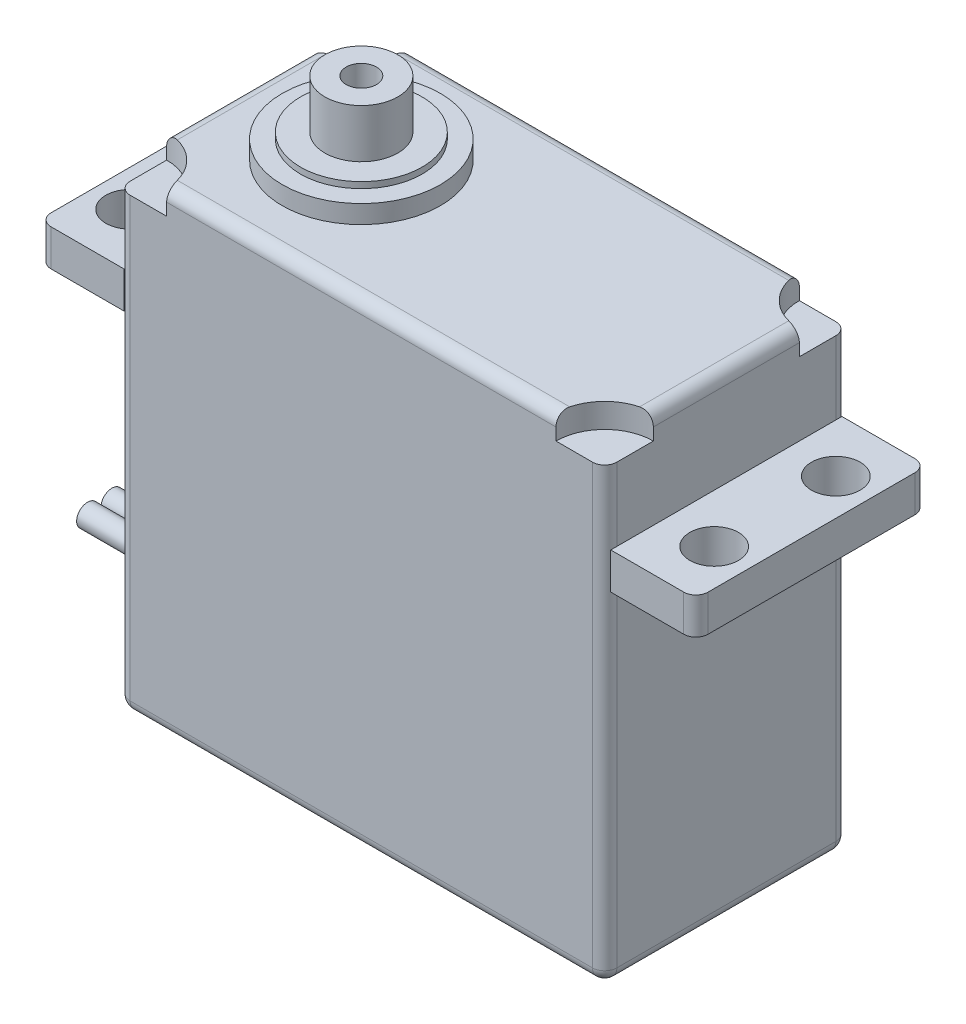
from build123d import *

# Parameters (mm, degrees)
SKETCH_2_W                = 40
SKETCH_2_H                = 39
EXTRUDE_1_DEPTH           = 10
FILLET_1_R                = 1
SKETCH_6_R                = 4
CUT_EXTRUDE_1_DEPTH       = 2
HOLE_WIZARD_2_0_2_2_D     = 2
HOLE_WIZARD_2_0_2_2_DEPTH = 10
HOLE_WIZARD_2_0_2_2_TIP   = 0.600860619
EXTRUDE_START             = -8
SKETCH_16_W               = 7
SKETCH_16_H               = 19
SKETCH_16_R               = 2
EXTRUDE_2_DEPTH           = 3
SKETCH_17_R               = 6.5
EXTRUDE_3_DEPTH           = 1.5
SKETCH_18_R               = 5
EXTRUDE_4_DEPTH           = 0.5
SKETCH_19_R               = 3
EXTRUDE_5_DEPTH           = 4
FILLET_2_R                = 1
HOLE_WIZARD_M3_1_D        = 2.5
HOLE_WIZARD_M3_1_DEPTH    = 5.55
HOLE_WIZARD_M3_1_TIP      = 0.751075774
SKETCH_22_W               = 7.5
SKETCH_22_H               = 5
EXTRUDE_6_DEPTH           = 1
LOFT_1_OUTLINE_W          = 3.5
LOFT_1_OUTLINE_H          = 6
LOFT_1_DEPTH              = 4.5
LOFT_1_DRAFT              = -3.1798301
SKETCH_26_R               = 0.9
EXTRUDE_8_DEPTH           = 5


# Read off the part's stored shape, not the designer's step: 放样1
with BuildPart() as part:
    # 草图2 → 凸台-拉伸1 (new, symmetric)
    with BuildSketch(Plane.XY):
        with Locations((20, -19.5)):
            Rectangle(SKETCH_2_W, SKETCH_2_H)
    extrude(amount=EXTRUDE_1_DEPTH, both=True)

    # 圆角1
    fillet_1_edges = [part.edges().sort_by_distance(p)[0] for p in [
        (40, -19.5, 10),
        (20, 0, 10),
        (0, -19.5, 10),
        (20, 0, -10),
        (40, -19.5, -10),
        (20, -39, -10),
        (0, -19.5, -10),
        (20, -39, 10),
        (0, 0, 0),
        (40, 0, 0),
        (40, -39, 0),
        (0, -39, 0),
    ]]
    fillet(fillet_1_edges, radius=FILLET_1_R)

    # 草图6 → 切除-拉伸1 (cut)
    with BuildSketch(Plane.XZ):
        with Locations((0, 10)):
            Circle(SKETCH_6_R)
        with Locations((40, 10)):
            Circle(SKETCH_6_R)
        with Locations((40, -10)):
            Circle(SKETCH_6_R)
        with Locations((0, -10)):
            Circle(SKETCH_6_R)
    extrude(amount=CUT_EXTRUDE_1_DEPTH, mode=Mode.SUBTRACT)

    # Ø2.0 (2) 直径孔2
    with Locations(Plane(origin=(0, -39, 0), x_dir=(-1, 0, 0), z_dir=(0, -1, 0))):
        with Locations((-37.5, 7.5), (-37.5, -7.5), (-2.5, 7.5), (-2.5, -7.5)):
            Hole(HOLE_WIZARD_2_0_2_2_D / 2, depth=HOLE_WIZARD_2_0_2_2_DEPTH)
            with Locations((0, 0, -(HOLE_WIZARD_2_0_2_2_DEPTH + HOLE_WIZARD_2_0_2_2_TIP / 2))):  # 118° drill point
                Cone(0, HOLE_WIZARD_2_0_2_2_D / 2, HOLE_WIZARD_2_0_2_2_TIP, mode=Mode.SUBTRACT)

    # 草图16 → 凸台-拉伸2 (add)
    # profile 1 of 2: a face of its own
    with BuildSketch(Plane(origin=(0, 0, 0), x_dir=(1, 0, 0), z_dir=(0, 1, 0)).offset(EXTRUDE_START)):
        with Locations((-3.5, 0)):
            Rectangle(SKETCH_16_W, SKETCH_16_H)
        with Locations(Location((-4, -5, 0), (0, 0, 270))):
            Circle(SKETCH_16_R, mode=Mode.SUBTRACT)
        with Locations(Location((-4, 5, 0), (0, 0, 270))):
            Circle(SKETCH_16_R, mode=Mode.SUBTRACT)
    # profile 2 of 2: a face of its own
    with BuildSketch(Plane(origin=(0, 0, 0), x_dir=(1, 0, 0), z_dir=(0, 1, 0)).offset(EXTRUDE_START)):
        with Locations((43.5, 0)):
            Rectangle(SKETCH_16_W, SKETCH_16_H)
        with Locations(Location((44, 5, 0), (0, 0, 90))):
            Circle(SKETCH_16_R, mode=Mode.SUBTRACT)
        with Locations(Location((44, -5, 0), (0, 0, 90))):
            Circle(SKETCH_16_R, mode=Mode.SUBTRACT)
    extrude(amount=-EXTRUDE_2_DEPTH)

    # 草图17 → 凸台-拉伸3 (add)
    with BuildSketch(Plane(origin=(0, 0, 0), x_dir=(1, 0, 0), z_dir=(0, 1, 0))):
        with Locations(Location((10, 0, 0), (0, 0, 90))):
            Circle(SKETCH_17_R)
    extrude(amount=EXTRUDE_3_DEPTH)

    # 草图18 → 凸台-拉伸4 (add)
    with BuildSketch(Plane(origin=(0, 1.5, 0), x_dir=(1, 0, 0), z_dir=(0, 1, 0))):
        with Locations(Location((10, 0, 0), (0, 0, 270))):
            Circle(SKETCH_18_R)
    extrude(amount=EXTRUDE_4_DEPTH)

    # 草图19 → 凸台-拉伸5 (add)
    with BuildSketch(Plane(origin=(0, 2, 0), x_dir=(1, 0, 0), z_dir=(0, 1, 0))):
        with Locations(Location((10, 0, 0), (0, 0, 270))):
            Circle(SKETCH_19_R)
    extrude(amount=EXTRUDE_5_DEPTH)

    # 圆角2
    fillet_2_edges = [part.edges().sort_by_distance(p)[0] for p in [
        (-7, -9.5, 9.5),
        (-7, -9.5, -9.5),
        (47, -9.5, 9.5),
        (47, -9.5, -9.5),
    ]]
    fillet(fillet_2_edges, radius=FILLET_2_R)

    # M3 螺纹孔1
    with Locations(Plane(origin=(0, 6, 0), x_dir=(1, 0, 0), z_dir=(0, 1, 0))):
        with Locations((10, 0)):
            Hole(HOLE_WIZARD_M3_1_D / 2, depth=HOLE_WIZARD_M3_1_DEPTH)
            with Locations((0, 0, -(HOLE_WIZARD_M3_1_DEPTH + HOLE_WIZARD_M3_1_TIP / 2))):  # 118° drill point
                Cone(0, HOLE_WIZARD_M3_1_D / 2, HOLE_WIZARD_M3_1_TIP, mode=Mode.SUBTRACT)

    # 草图22 → 凸台-拉伸6 (add)
    with BuildSketch(Plane.ZY):
        with Locations((0, -34.5)):
            Rectangle(SKETCH_22_W, SKETCH_22_H)
    extrude(amount=EXTRUDE_6_DEPTH)


with BuildPart() as loft_1_tool:
    # 放样1 outline → 放样1 (with draft: the straight prism first)
    with BuildSketch(Plane.YZ.offset(-5.5)):
        with Locations((-34.5, 0)):
            Rectangle(LOFT_1_OUTLINE_W, LOFT_1_OUTLINE_H)
    extrude(amount=LOFT_1_DEPTH)
    # 放样1: the draft: its side faces are tilted about the plane it starts from
    loft_1_sides = [loft_1_tool.faces().sort_by_distance(p)[0] for p in [
        (-3.25, -36.25, 0),
        (-3.25, -34.5, -3),
        (-3.25, -32.75, 0),
        (-3.25, -34.5, 3),
    ]]
    draft(loft_1_sides, Plane.YZ.offset(-5.5), LOFT_1_DRAFT)


with BuildPart() as part_1:
    add(part.part)

    # 放样1: add loft_1_tool
    add(loft_1_tool.part)

    # 草图26 → 凸台-拉伸8 (add)
    with BuildSketch(Plane.ZY.offset(5.5)):
        with Locations((-2, -34.5)):
            Circle(SKETCH_26_R)
        with Locations((0, -34.5)):
            Circle(SKETCH_26_R)
        with Locations((2, -34.5)):
            Circle(SKETCH_26_R)
    extrude(amount=EXTRUDE_8_DEPTH)


solid = part_1.part
